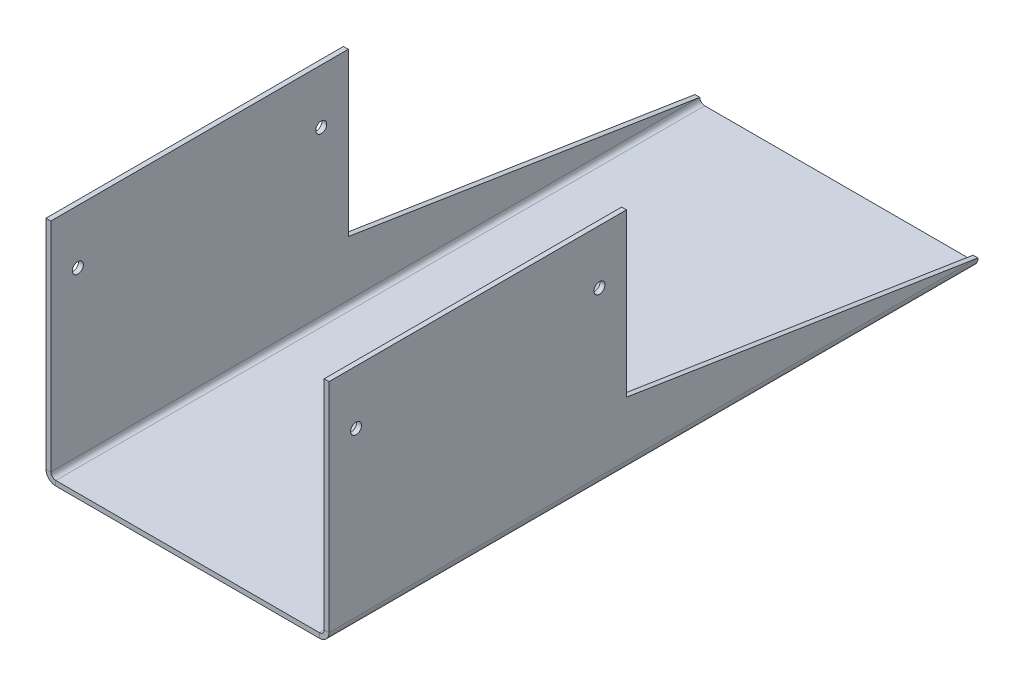
from build123d import *

# Parameters (mm, degrees)
BASE_FLANGE1_DEPTH = 304.8
CUT_EXTRUDE3_DEPTH = 350.224373693
SKETCH9_R          = 2.5796875
CUT_EXTRUDE4_DEPTH = 350.224373693


# Sheet-metal steps are written as plain solids
with BuildPart() as part:
    # Sketch1 → Base-Flange1 (new body)
    with BuildSketch(Plane.XY):
        with BuildLine():
            Line((0, 106.68), (0, 4.572))
            ThreePointArc((0, 4.572), (1.339107796, 1.339107796), (4.572, 0))
            Line((4.572, 0), (128.3716, 0))
            ThreePointArc((128.3716, 0), (131.604492204, 1.339107796), (132.9436, 4.572))
            Line((132.9436, 4.572), (132.9436, 106.68))
            Line((132.9436, 106.68), (130.6576, 106.68))
            Line((130.6576, 106.68), (130.6576, 4.572))
            ThreePointArc((130.6576, 4.572), (129.988046102, 2.955553898), (128.3716, 2.286))
            Line((128.3716, 2.286), (4.572, 2.286))
            ThreePointArc((4.572, 2.286), (2.955553898, 2.955553898), (2.286, 4.572))
            Line((2.286, 4.572), (2.286, 106.68))
            Line((2.286, 106.68), (0, 106.68))
        make_face()
    extrude(amount=BASE_FLANGE1_DEPTH)

    # Sketch6 → Cut-Extrude3 (cut, through all)
    with BuildSketch(Plane(origin=(132.9436, 0, 0), x_dir=(0, 0, -1), z_dir=(1, 0, 0))):
        Polygon((0, 4.572), (0, 106.68), (-165.1, 106.68), (-165.1, 30.48), align=None)
    extrude(amount=-CUT_EXTRUDE3_DEPTH, mode=Mode.SUBTRACT)

    # Sketch9 → Cut-Extrude4 (cut, through all)
    with BuildSketch(Plane.ZY):
        with Locations(Location((177.8, 81.28, 0), (0, 0, 270))):
            Circle(SKETCH9_R)
        with Locations(Location((292.1, 81.28, 0), (0, 0, 270))):
            Circle(SKETCH9_R)
    extrude(amount=-CUT_EXTRUDE4_DEPTH, mode=Mode.SUBTRACT)


solid = part.part
